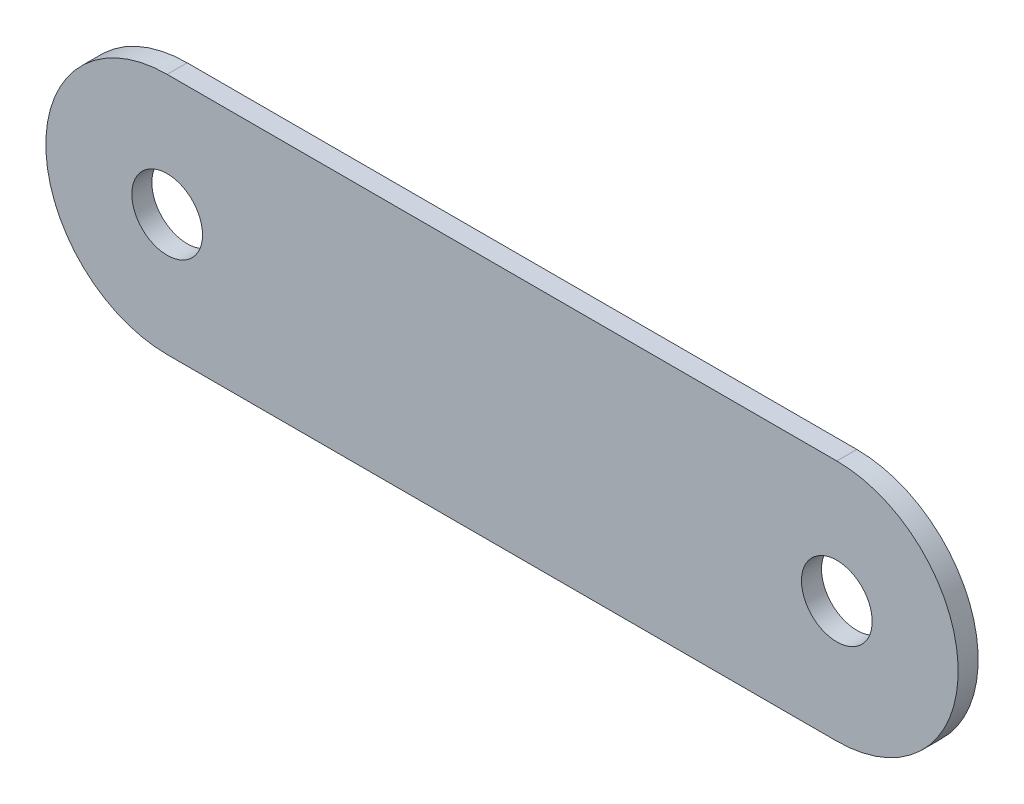
from build123d import *

# Parameters (mm, degrees)
SKETCH1_R           = 5.3
BOSS_EXTRUDE1_DEPTH = 3


with BuildPart() as part:
    # Sketch1 → Boss-Extrude1 (new body)
    with BuildSketch(Plane.XY):
        with BuildLine():
            Line((-50.205, 18.193025217), (50.205, 18.193025217))
            ThreePointArc((50.205, 18.193025217), (68.398025217, 0), (50.205, -18.193025217))
            Line((50.205, -18.193025217), (-50.205, -18.193025217))
            ThreePointArc((-50.205, -18.193025217), (-68.398025217, 0), (-50.205, 18.193025217))
        make_face()
        with Locations((-50.205, 0)):
            Circle(SKETCH1_R, mode=Mode.SUBTRACT)
        with Locations((50.205, 0)):
            Circle(SKETCH1_R, mode=Mode.SUBTRACT)
    extrude(amount=BOSS_EXTRUDE1_DEPTH)


solid = part.part
